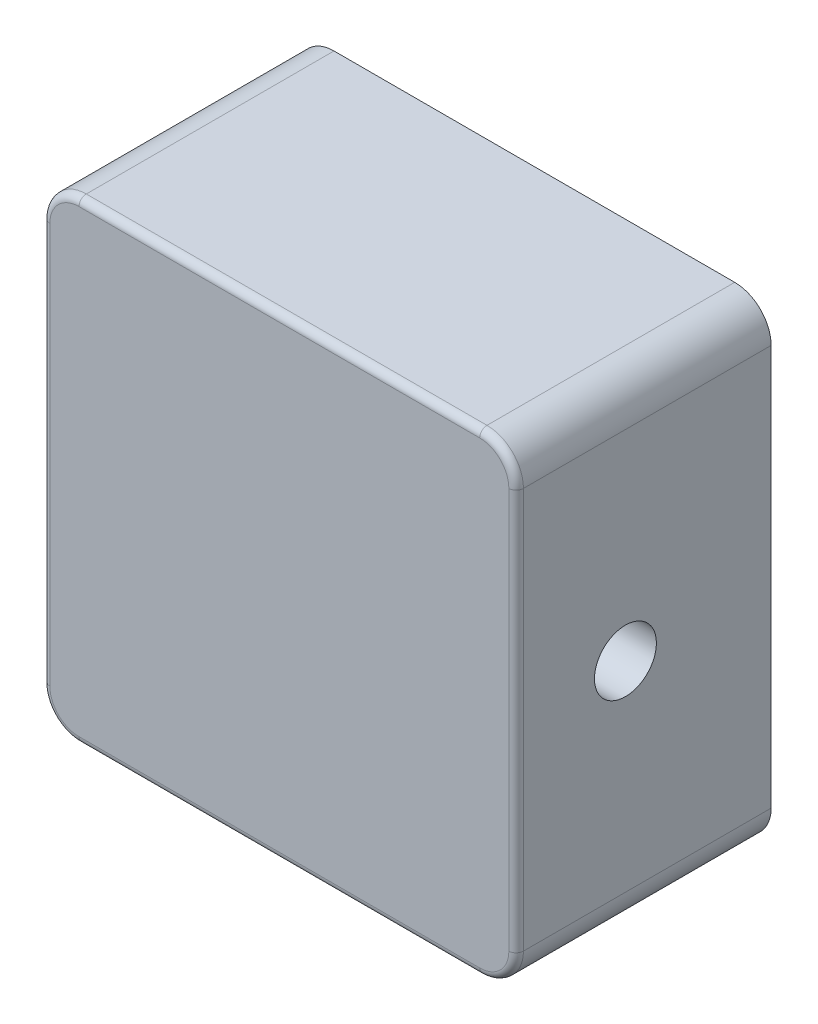
from build123d import *

# Parameters (mm, degrees)
SKETCH2_W               = 330.2
SKETCH2_H               = 330.2
BOSS_EXTRUDE1_DEPTH     = 177.8
CUT_EXTRUDE1_DEPTH      = 410.759551445
CUT_EXTRUDE1_DEPTH_BACK = 410.759551445
SKETCH3_R               = 21.59
SKETCH5_R               = 8.382
CUT_EXTRUDE3_DEPTH      = 101.6
SKETCH6_R               = 21.59
CUT_EXTRUDE4_DEPTH      = 165.1
FILLET1_R               = 5.08
FILLET2_R               = 25.4


with BuildPart() as part:
    # Sketch2 → Boss-Extrude1 (new body)
    with BuildSketch(Plane.XY):
        Rectangle(SKETCH2_W, SKETCH2_H)
    extrude(amount=BOSS_EXTRUDE1_DEPTH)

    # Sketch3 → Cut-Extrude1 (cut, two sides: drawn at the far end of the back side and taken through both)
    with BuildSketch(Plane(origin=(165.1, 0, 0), x_dir=(0, 0, -1), z_dir=(1, 0, 0)).offset(-CUT_EXTRUDE1_DEPTH_BACK)):
        with Locations((-101.6, 0)):
            Circle(SKETCH3_R)
    extrude(amount=CUT_EXTRUDE1_DEPTH + CUT_EXTRUDE1_DEPTH_BACK, mode=Mode.SUBTRACT)

    # Sketch5 → Cut-Extrude3 (cut)
    with BuildSketch(Plane(origin=(0, 0, 0), x_dir=(-1, 0, 0), z_dir=(0, 0, -1))):
        Circle(SKETCH5_R)
    extrude(amount=-CUT_EXTRUDE3_DEPTH, mode=Mode.SUBTRACT)

    # Sketch6 → Cut-Extrude4 (cut)
    with BuildSketch(Plane.XZ.offset(165.1)):
        with Locations(Location((0, 101.6, 0), (0, 0, 270))):
            Circle(SKETCH6_R)
    extrude(amount=-CUT_EXTRUDE4_DEPTH, mode=Mode.SUBTRACT)

    # Fillet1
    fillet1_edges = [part.edges().sort_by_distance(p)[0] for p in [
        (-165.1, 0, 177.8),
        (0, -165.1, 177.8),
        (165.1, 0, 177.8),
        (0, 165.1, 177.8),
    ]]
    fillet(fillet1_edges, radius=FILLET1_R)

    # Fillet2
    # the kernel refuses this fillet: 25.4 mm, written as the material it takes off along each edge
    with BuildSketch(Plane(origin=(-139.7, 139.7, 177.8), x_dir=(0, 1, 0), z_dir=(1, 0, 0))) as fillet2_piece_1:
        with BuildLine():
            CenterArc((20.32, -5.08), 5.08, 0, 90)
            Line((25.4, -5.08), (25.4, 0))
            Line((25.4, 0), (20.32, 0))
        make_face()
    revolve(axis=Axis((-139.7, 139.7, 177.8), (0, 0, 1)), revolution_arc=90, mode=Mode.SUBTRACT)
    with BuildSketch(Plane(origin=(139.7, 139.7, 177.8), x_dir=(1, 0, 0), z_dir=(0, -1, 0))) as fillet2_piece_2:
        with BuildLine():
            CenterArc((20.32, -5.08), 5.08, 0, 90)
            Line((25.4, -5.08), (25.4, 0))
            Line((25.4, 0), (20.32, 0))
        make_face()
    revolve(axis=Axis((139.7, 139.7, 177.8), (0, 0, 1)), revolution_arc=90, mode=Mode.SUBTRACT)
    with BuildSketch(Plane(origin=(-139.7, -139.7, 177.8), x_dir=(-1, 0, 0), z_dir=(0, 1, 0))) as fillet2_piece_3:
        with BuildLine():
            CenterArc((20.32, -5.08), 5.08, 0, 90)
            Line((25.4, -5.08), (25.4, 0))
            Line((25.4, 0), (20.32, 0))
        make_face()
    revolve(axis=Axis((-139.7, -139.7, 177.8), (0, 0, 1)), revolution_arc=90, mode=Mode.SUBTRACT)
    with BuildSketch(Plane(origin=(139.7, -139.7, 177.8), x_dir=(0, -1, 0), z_dir=(-1, 0, 0))) as fillet2_piece_4:
        with BuildLine():
            CenterArc((20.32, -5.08), 5.08, 0, 90)
            Line((25.4, -5.08), (25.4, 0))
            Line((25.4, 0), (20.32, 0))
        make_face()
    revolve(axis=Axis((139.7, -139.7, 177.8), (0, 0, 1)), revolution_arc=90, mode=Mode.SUBTRACT)
    with BuildSketch(Plane(origin=(165.1, -165.1, -63.5), x_dir=(-1, 0, 0), z_dir=(0, 0, 1)), Plane(origin=(165.1, 165.1, -63.5), x_dir=(0, -1, 0), z_dir=(0, 0, 1))) as fillet2_piece_5:
        with BuildLine():
            CenterArc((FILLET2_R, -FILLET2_R), FILLET2_R, 90, 90)
            Line((0, -FILLET2_R), (0, 0))
            Line((0, 0), (FILLET2_R, 0))
        make_face()
    extrude(amount=241.3, mode=Mode.SUBTRACT)
    with BuildSketch(Plane(origin=(-165.1, -165.1, -63.5), x_dir=(1, 0, 0), z_dir=(0, 0, 1)), Plane(origin=(-165.1, 165.1, -63.5), x_dir=(0, -1, 0), z_dir=(0, 0, 1))) as fillet2_piece_6:
        with BuildLine():
            CenterArc((FILLET2_R, FILLET2_R), FILLET2_R, 180, 90)
            Line((0, FILLET2_R), (0, 0))
            Line((0, 0), (FILLET2_R, 0))
        make_face()
    extrude(amount=241.3, mode=Mode.SUBTRACT)


solid = part.part
